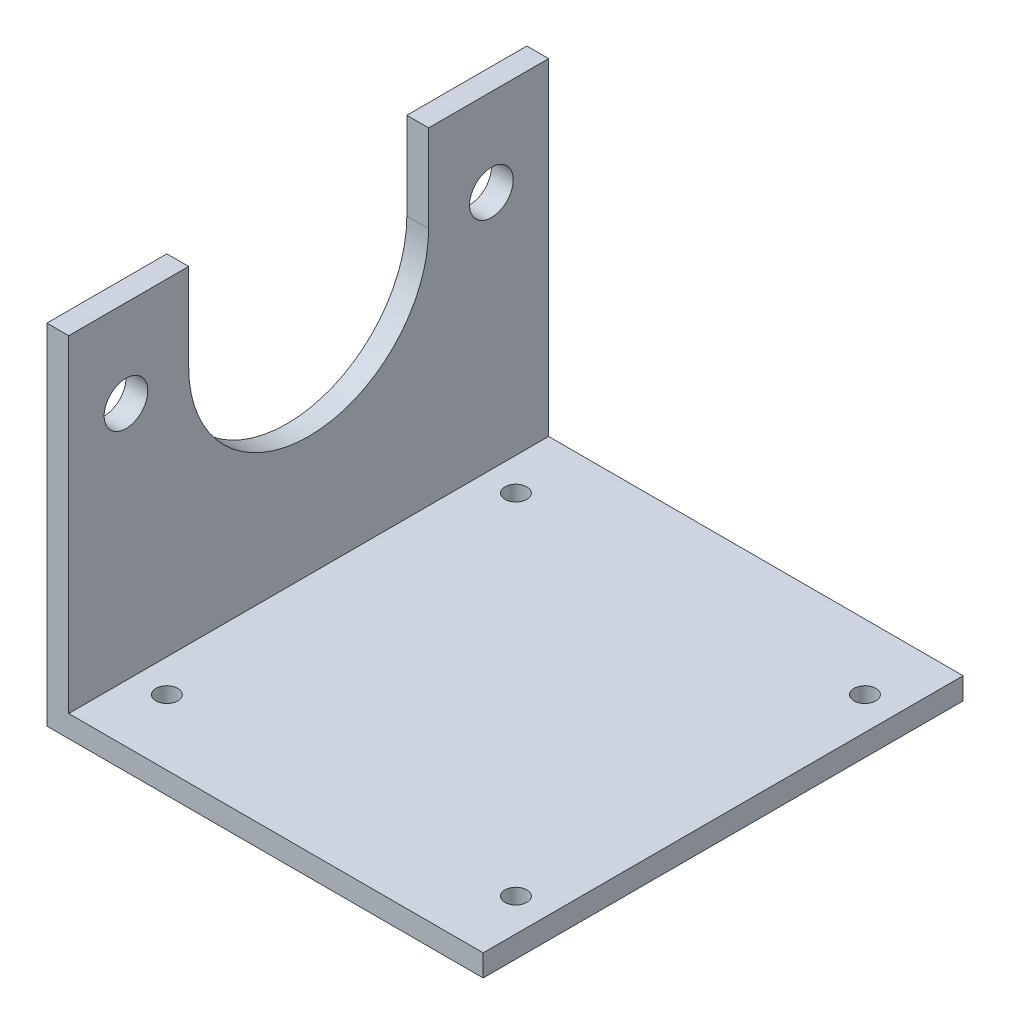
from build123d import *

# Parameters (mm, degrees)
BOSS_EXTRUDE1_DEPTH = 69.85
CUT_EXTRUDE1_REACH  = 170.843
SKETCH2_R           = 6.35
CUT_EXTRUDE2_REACH  = 170.843
SKETCH3_R           = 3.175


with BuildPart() as part:
    # Sketch1 → Boss-Extrude1 (new, symmetric)
    with BuildSketch(Plane.XY):
        Polygon((0, 0), (0, 95.25), (-6.35, 95.25), (-6.35, -6.35), (120.65, -6.35), (120.65, 0), align=None)
    extrude(amount=BOSS_EXTRUDE1_DEPTH, both=True)

    # Sketch2 → Cut-Extrude1 (cut, up to next)
    with BuildSketch(Plane(origin=(0, 0, 0), x_dir=(0, 0, -1), z_dir=(1, 0, 0)), mode=Mode.PRIVATE) as cut_extrude1_sk1:
        with Locations((-53.1876, 69.85)):
            Circle(SKETCH2_R)
    cut_extrude1_tool1 = extrude(cut_extrude1_sk1.sketch, amount=-CUT_EXTRUDE1_REACH, mode=Mode.PRIVATE) & part.part
    # Sketch2 → Cut-Extrude1 (cut, up to next)
    with BuildSketch(Plane(origin=(0, 0, 0), x_dir=(0, 0, -1), z_dir=(1, 0, 0)), mode=Mode.PRIVATE) as cut_extrude1_sk2:
        with Locations((53.1876, 69.85)):
            Circle(SKETCH2_R)
    cut_extrude1_tool2 = extrude(cut_extrude1_sk2.sketch, amount=-CUT_EXTRUDE1_REACH, mode=Mode.PRIVATE) & part.part
    # Sketch2 → Cut-Extrude1 (cut, up to next)
    with BuildSketch(Plane(origin=(0, 0, 0), x_dir=(0, 0, -1), z_dir=(1, 0, 0)), mode=Mode.PRIVATE) as cut_extrude1_sk3:
        with BuildLine():
            Line((-34.925, 69.85), (-34.925, 95.25))
            Line((-34.925, 95.25), (34.925, 95.25))
            Line((34.925, 95.25), (34.925, 69.85))
            ThreePointArc((34.925, 69.85), (0, 34.925), (-34.925, 69.85))
        make_face()
    cut_extrude1_tool3 = extrude(cut_extrude1_sk3.sketch, amount=-CUT_EXTRUDE1_REACH, mode=Mode.PRIVATE) & part.part
    add(cut_extrude1_tool1.solids().sort_by_distance((0, 69.85, 53.1876))[0], mode=Mode.SUBTRACT)
    add(cut_extrude1_tool2.solids().sort_by_distance((0, 69.85, -53.1876))[0], mode=Mode.SUBTRACT)
    add(cut_extrude1_tool3.solids().sort_by_distance((0, 68.259897, 0))[0], mode=Mode.SUBTRACT)

    # Sketch3 → Cut-Extrude2 (cut, up to next)
    with BuildSketch(Plane(origin=(0, 0, 0), x_dir=(1, 0, 0), z_dir=(0, 1, 0)), mode=Mode.PRIVATE) as cut_extrude2_sk1:
        with Locations((9.525, 50.8)):
            Circle(SKETCH3_R)
    cut_extrude2_tool1 = extrude(cut_extrude2_sk1.sketch, amount=-CUT_EXTRUDE2_REACH, mode=Mode.PRIVATE) & part.part
    # Sketch3 → Cut-Extrude2 (cut, up to next)
    with BuildSketch(Plane(origin=(0, 0, 0), x_dir=(1, 0, 0), z_dir=(0, 1, 0)), mode=Mode.PRIVATE) as cut_extrude2_sk2:
        with Locations((111.125, 50.8)):
            Circle(SKETCH3_R)
    cut_extrude2_tool2 = extrude(cut_extrude2_sk2.sketch, amount=-CUT_EXTRUDE2_REACH, mode=Mode.PRIVATE) & part.part
    # Sketch3 → Cut-Extrude2 (cut, up to next)
    with BuildSketch(Plane(origin=(0, 0, 0), x_dir=(1, 0, 0), z_dir=(0, 1, 0)), mode=Mode.PRIVATE) as cut_extrude2_sk3:
        with Locations((9.525, -50.8)):
            Circle(SKETCH3_R)
    cut_extrude2_tool3 = extrude(cut_extrude2_sk3.sketch, amount=-CUT_EXTRUDE2_REACH, mode=Mode.PRIVATE) & part.part
    # Sketch3 → Cut-Extrude2 (cut, up to next)
    with BuildSketch(Plane(origin=(0, 0, 0), x_dir=(1, 0, 0), z_dir=(0, 1, 0)), mode=Mode.PRIVATE) as cut_extrude2_sk4:
        with Locations((111.125, -50.8)):
            Circle(SKETCH3_R)
    cut_extrude2_tool4 = extrude(cut_extrude2_sk4.sketch, amount=-CUT_EXTRUDE2_REACH, mode=Mode.PRIVATE) & part.part
    add(cut_extrude2_tool1.solids().sort_by_distance((9.525, 0, -50.8))[0], mode=Mode.SUBTRACT)
    add(cut_extrude2_tool2.solids().sort_by_distance((111.125, 0, -50.8))[0], mode=Mode.SUBTRACT)
    add(cut_extrude2_tool3.solids().sort_by_distance((9.525, 0, 50.8))[0], mode=Mode.SUBTRACT)
    add(cut_extrude2_tool4.solids().sort_by_distance((111.125, 0, 50.8))[0], mode=Mode.SUBTRACT)


solid = part.part
